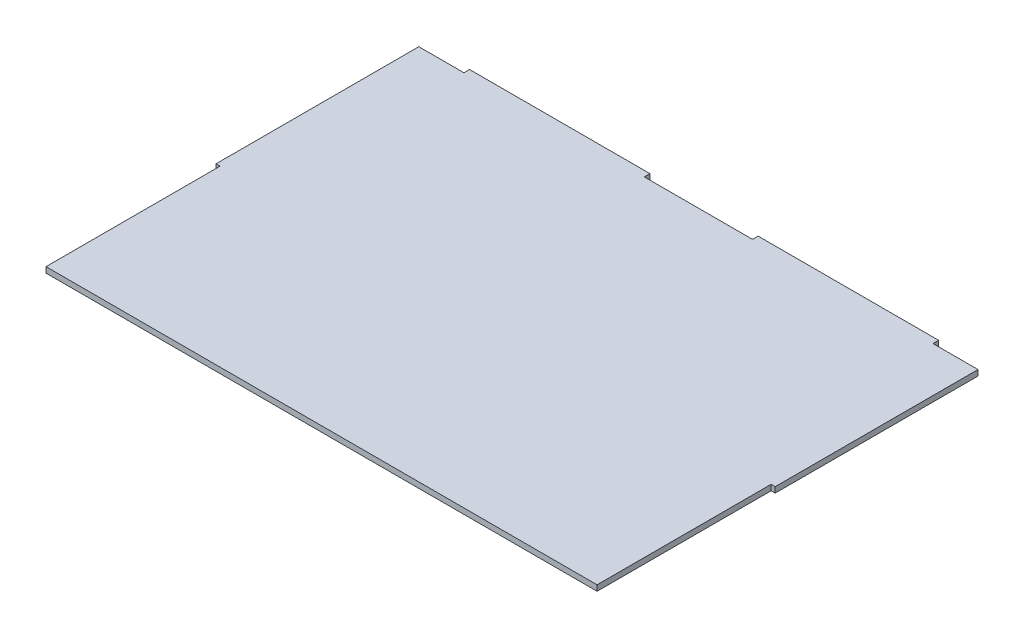
from build123d import *

# Parameters (mm, degrees)
SKETCH1_W           = 314.96461264
SKETCH1_H           = 3.175
BOSS_EXTRUDE1_DEPTH = 235.775
SKETCH3_W           = 25.4
SKETCH3_H           = 3.175
SKETCH3_W_2         = 60.96461264
CUT_EXTRUDE1_DEPTH  = 3.175
CUT_EXTRUDE2_START  = -3.175
SKETCH5_W           = 2.286
SKETCH5_H           = 118.364
CUT_EXTRUDE2_DEPTH  = 287.725009793
SKETCH6_W           = 310.39261264
SKETCH6_H           = 20.32
CUT_EXTRUDE4_DEPTH  = 284.550009793


with BuildPart() as part:
    # Sketch1 → Boss-Extrude1 (new body)
    with BuildSketch(Plane.XY):
        Rectangle(SKETCH1_W, SKETCH1_H)
    extrude(amount=BOSS_EXTRUDE1_DEPTH)

    # Sketch3 → Cut-Extrude1 (cut)
    with BuildSketch(Plane(origin=(0, 0, 0), x_dir=(-1, 0, 0), z_dir=(0, 0, -1))):
        with Locations((-144.78230632, 0)):
            Rectangle(SKETCH3_W, SKETCH3_H)
        Rectangle(SKETCH3_W_2, SKETCH3_H)
        with Locations((144.78230632, 0)):
            Rectangle(SKETCH3_W, SKETCH3_H)
    extrude(amount=-CUT_EXTRUDE1_DEPTH, mode=Mode.SUBTRACT)

    # Sketch5 → Cut-Extrude2 (cut)
    with BuildSketch(Plane(origin=(0, 1.5875, 0), x_dir=(1, 0, 0), z_dir=(0, 1, 0)).offset(CUT_EXTRUDE2_START)):
        with Locations((-156.33930632, -176.593)):
            Rectangle(SKETCH5_W, SKETCH5_H)
    cut_extrude2 = extrude(amount=CUT_EXTRUDE2_DEPTH, mode=Mode.SUBTRACT)

    # Mirror1: Cut-Extrude2 across plane
    add(cut_extrude2.mirror(Plane(origin=(0, 0, 0), x_dir=(0, 0, 1), z_dir=(1, 0, 0))), mode=Mode.SUBTRACT)

    # Sketch6 → Cut-Extrude4 (cut, through all)
    with BuildSketch(Plane(origin=(0, 1.5875, 0), x_dir=(1, 0, 0), z_dir=(0, 1, 0))):
        with Locations((0, -225.615)):
            Rectangle(SKETCH6_W, SKETCH6_H)
    extrude(amount=-CUT_EXTRUDE4_DEPTH, mode=Mode.SUBTRACT)


solid = part.part
